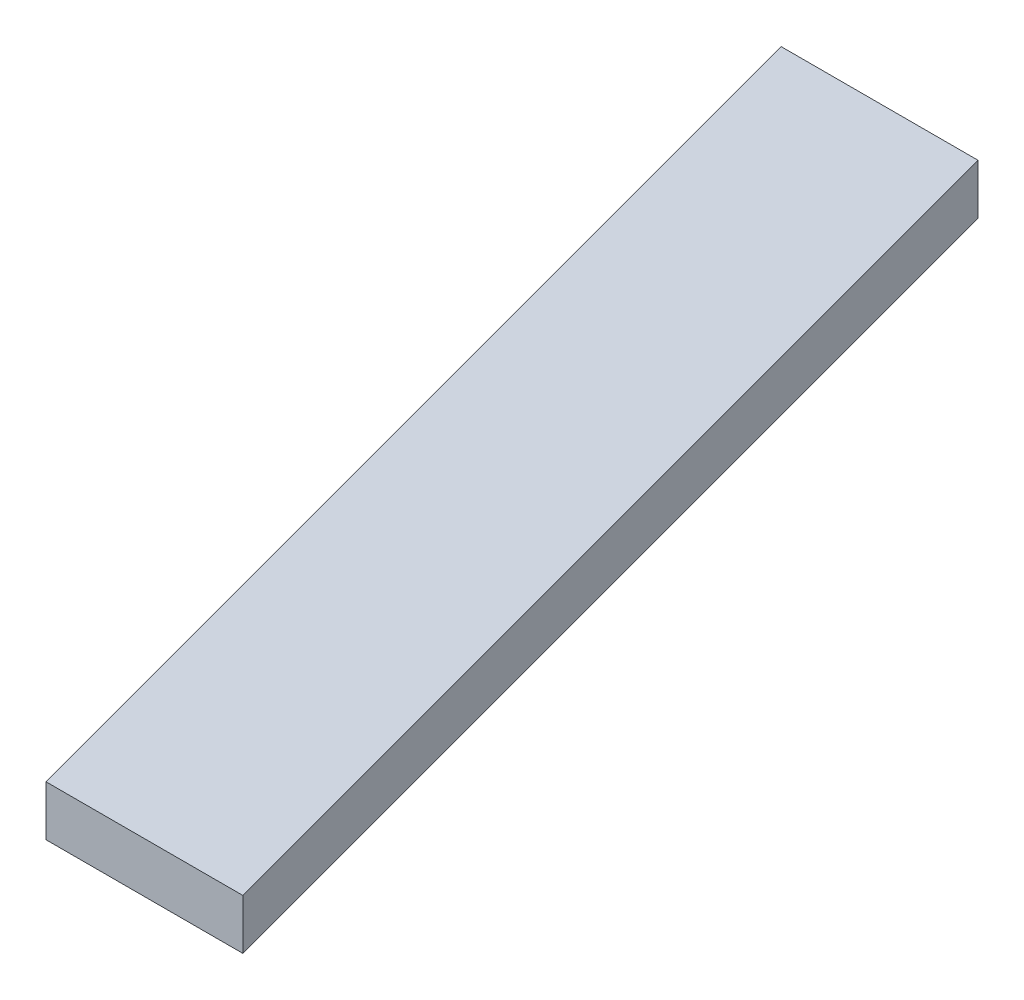
from build123d import *

# Parameters (mm, degrees)
BOSS_EXTRUDE1_DEPTH = 3.175


with BuildPart() as part:
    # Sketch2 → Boss-Extrude1 (new body)
    with BuildSketch(Plane(origin=(0, 0, 0), x_dir=(1, 0, 0), z_dir=(0, 1, 0))):
        Polygon((0, 0), (12.446, 0), (29.460773719, -63.5), (17.014773719, -63.5), align=None)
    extrude(amount=BOSS_EXTRUDE1_DEPTH)


solid = part.part
